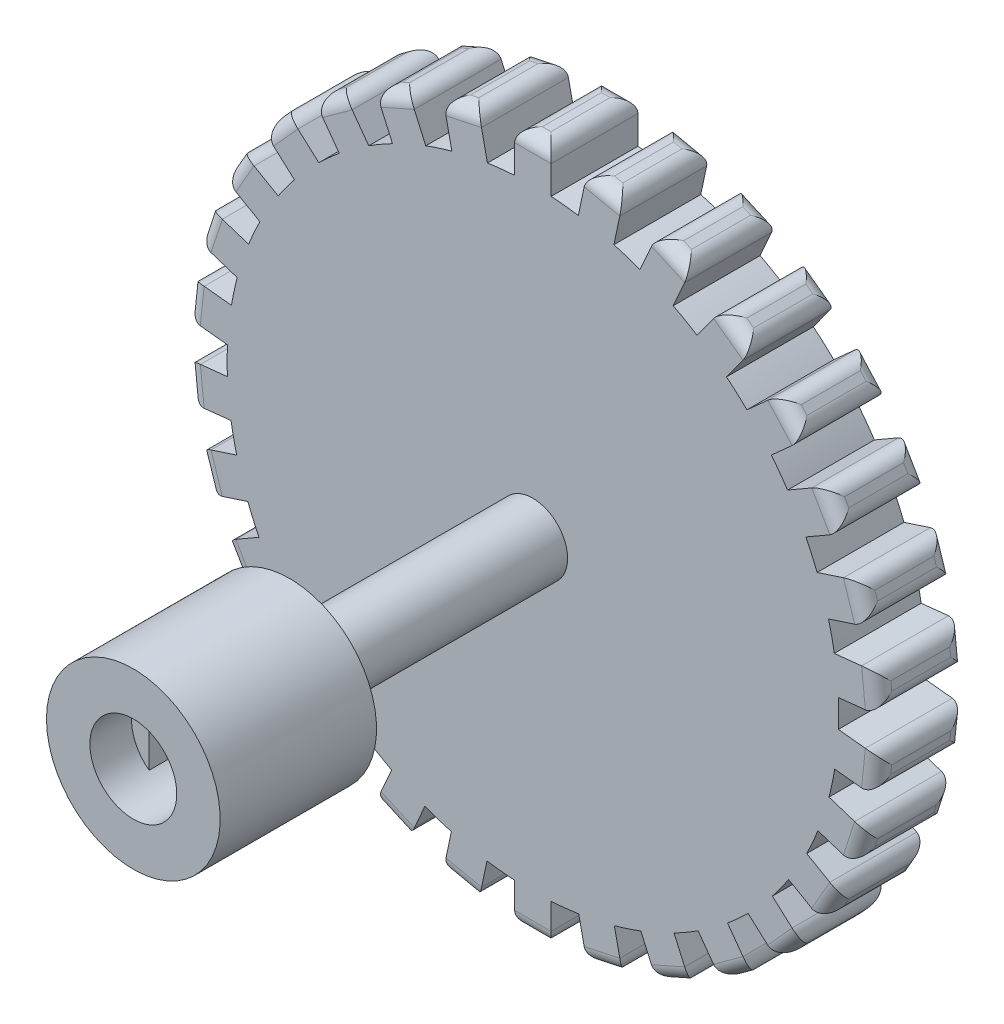
from build123d import *

# Parameters (mm, degrees)
SKETCH1_R                = 88
BOSS_EXTRUDE3_DEPTH      = 25
SKETCH4_W                = 10.4719
SKETCH4_H                = 13.351164338
BOSS_EXTRUDE4_DEPTH      = 25
FILLET2_R                = 4
CIRPATTERN1_COUNT        = 30
FILLET2_OF_CIRPATTERN1_R = 4
SKETCH6_R                = 10
BOSS_EXTRUDE5_DEPTH      = 60
BOSS_EXTRUDE6_START      = 10
SKETCH7_R                = 10
BOSS_EXTRUDE6_DEPTH      = 10
SKETCH8_R                = 10
BOSS_EXTRUDE7_DEPTH      = 10
SKETCH9_R                = 10
BOSS_EXTRUDE8_DEPTH      = 25
SKETCH10_R               = 10
BOSS_EXTRUDE9_DEPTH      = 42.5
SKETCH12_R               = 12.5
CUT_EXTRUDE1_DEPTH       = 12
CUT_EXTRUDE2_START       = -55.5
SKETCH13_R               = 10
CUT_EXTRUDE2_DEPTH       = 55.5
SKETCH14_R               = 25
BOSS_EXTRUDE10_DEPTH     = 45
SKETCH15_R               = 12.5
CUT_EXTRUDE3_DEPTH       = 12
CUT_EXTRUDE4_DEPTH       = 30.5


with BuildPart() as part:
    # Sketch1 → Boss-Extrude3 (new body)
    with BuildSketch(Plane.XY):
        Circle(SKETCH1_R)
    extrude(amount=BOSS_EXTRUDE3_DEPTH)

    # Sketch4 → Boss-Extrude4 (add)
    with BuildSketch(Plane.XY.offset(25)):
        with Locations((0, 93.324417831)):
            Rectangle(SKETCH4_W, SKETCH4_H)
    boss_extrude4 = extrude(amount=-BOSS_EXTRUDE4_DEPTH)

    # Fillet2
    fillet2_edges = [part.edges().sort_by_distance(p)[0] for p in [
        (5.23595, 100, 12.5),
        (0, 100, 0),
        (-5.23595, 100, 12.5),
        (0, 100, 25),
    ]]
    fillet(fillet2_edges, radius=FILLET2_R)

    # CirPattern1: Boss-Extrude4 ×30 about axis
    cirpattern1_axis = Axis((0, 0.317667884, 0), (0, 0, 1))
    for i in range(1, CIRPATTERN1_COUNT):
        add(boss_extrude4.rotate(cirpattern1_axis, i * 360 / CIRPATTERN1_COUNT))

    # Fillet2 of CirPattern1
    fillet2_of_cirpattern1_edges = [part.edges().sort_by_distance(p)[0] for p in [
        (-15.603590285, 98.910317096, 12.5),
        (-20.725122215, 97.821701879, 0),
        (-25.846654145, 96.733086661, 12.5),
        (-20.725122215, 97.821701879, 25),
        (-35.7611788, 93.511662322, 12.5),
        (-40.544457139, 91.382009596, 0),
        (-45.327735478, 89.252356869, 12.5),
        (-40.544457139, 91.382009596, 25),
        (-54.3558322, 84.039982796, 12.5),
        (-58.591804732, 80.962368605, 0),
        (-62.827777264, 77.884754413, 12.5),
        (-58.591804732, 80.962368605, 25),
        (-70.574874905, 70.909236365, 12.5),
        (-74.078409304, 67.018167216, 0),
        (-77.581943702, 63.127098067, 12.5),
        (-74.078409304, 67.018167216, 25),
        (-83.709456921, 54.693299655, 12.5),
        (-86.327431921, 50.158833942, 0),
        (-88.945406921, 45.624368229, 12.5),
        (-86.327431921, 50.158833942, 25),
        (-93.185533987, 36.100886913, 12.5),
        (-94.803531519, 31.121202547, 0),
        (-96.42152905, 26.14151818, 12.5),
        (-94.803531519, 31.121202547, 25),
        (-98.588956064, 15.944575793, 12.5),
        (-99.136261871, 10.737308875, 0),
        (-99.683567678, 5.530041957, 12.5),
        (-99.136261871, 10.737308875, 25),
        (-99.683567678, -4.894706189, 12.5),
        (-99.136261871, -10.101973107, 0),
        (-98.588956064, -15.309240025, 12.5),
        (-99.136261871, -10.101973107, 25),
        (-96.42152905, -25.506182413, 12.5),
        (-94.803531519, -30.485866779, 0),
        (-93.185533987, -35.465551145, 12.5),
        (-94.803531519, -30.485866779, 25),
        (-88.945406921, -44.989032461, 12.5),
        (-86.327431921, -49.523498174, 0),
        (-83.709456921, -54.057963887, 12.5),
        (-86.327431921, -49.523498174, 25),
        (-77.581943702, -62.491762299, 12.5),
        (-74.078409304, -66.382831448, 0),
        (-70.574874905, -70.273900597, 12.5),
        (-74.078409304, -66.382831448, 25),
        (-62.827777264, -77.249418645, 12.5),
        (-58.591804732, -80.327032837, 0),
        (-54.3558322, -83.404647029, 12.5),
        (-58.591804732, -80.327032837, 25),
        (-45.327735478, -88.617021102, 12.5),
        (-40.544457139, -90.746673828, 0),
        (-35.7611788, -92.876326554, 12.5),
        (-40.544457139, -90.746673828, 25),
        (-25.846654145, -96.097750894, 12.5),
        (-20.725122215, -97.186366111, 0),
        (-15.603590285, -98.274981329, 12.5),
        (-20.725122215, -97.186366111, 25),
        (-5.23595, -99.364664232, 12.5),
        (0, -99.364664232, 0),
        (5.23595, -99.364664232, 12.5),
        (0, -99.364664232, 25),
        (15.603590285, -98.274981329, 12.5),
        (20.725122215, -97.186366111, 0),
        (25.846654145, -96.097750894, 12.5),
        (20.725122215, -97.186366111, 25),
        (35.7611788, -92.876326554, 12.5),
        (40.544457139, -90.746673828, 0),
        (45.327735478, -88.617021102, 12.5),
        (40.544457139, -90.746673828, 25),
        (54.3558322, -83.404647029, 12.5),
        (58.591804732, -80.327032837, 0),
        (62.827777264, -77.249418645, 12.5),
        (58.591804732, -80.327032837, 25),
        (70.574874905, -70.273900597, 12.5),
        (74.078409304, -66.382831448, 0),
        (77.581943702, -62.491762299, 12.5),
        (74.078409304, -66.382831448, 25),
        (83.709456921, -54.057963887, 12.5),
        (86.327431921, -49.523498174, 0),
        (88.945406921, -44.989032461, 12.5),
        (86.327431921, -49.523498174, 25),
        (93.185533987, -35.465551145, 12.5),
        (94.803531519, -30.485866779, 0),
        (96.42152905, -25.506182413, 12.5),
        (94.803531519, -30.485866779, 25),
        (98.588956064, -15.309240025, 12.5),
        (99.136261871, -10.101973107, 0),
        (99.683567678, -4.894706189, 12.5),
        (99.136261871, -10.101973107, 25),
        (99.683567678, 5.530041957, 12.5),
        (99.136261871, 10.737308875, 0),
        (98.588956064, 15.944575793, 12.5),
        (99.136261871, 10.737308875, 25),
        (96.42152905, 26.14151818, 12.5),
        (94.803531519, 31.121202547, 0),
        (93.185533987, 36.100886913, 12.5),
        (94.803531519, 31.121202547, 25),
        (88.945406921, 45.624368229, 12.5),
        (86.327431921, 50.158833942, 0),
        (83.709456921, 54.693299655, 12.5),
        (86.327431921, 50.158833942, 25),
        (77.581943702, 63.127098067, 12.5),
        (74.078409304, 67.018167216, 0),
        (70.574874905, 70.909236365, 12.5),
        (74.078409304, 67.018167216, 25),
        (62.827777264, 77.884754413, 12.5),
        (58.591804732, 80.962368605, 0),
        (54.3558322, 84.039982796, 12.5),
        (58.591804732, 80.962368605, 25),
        (45.327735478, 89.252356869, 12.5),
        (40.544457139, 91.382009596, 0),
        (35.7611788, 93.511662322, 12.5),
        (40.544457139, 91.382009596, 25),
        (25.846654145, 96.733086661, 12.5),
        (20.725122215, 97.821701879, 0),
        (15.603590285, 98.910317096, 12.5),
        (20.725122215, 97.821701879, 25),
    ]]
    fillet(fillet2_of_cirpattern1_edges, radius=FILLET2_OF_CIRPATTERN1_R)

    # Sketch6 → Boss-Extrude5 (add)
    with BuildSketch(Plane.XY.offset(25)):
        Circle(SKETCH6_R)
    extrude(amount=BOSS_EXTRUDE5_DEPTH)

    # Sketch7 → Boss-Extrude6 (add)
    with BuildSketch(Plane(origin=(0, 0, 0), x_dir=(-1, 0, 0), z_dir=(0, 0, -1)).offset(BOSS_EXTRUDE6_START)):
        with Locations(Location((0, 0, 0), (0, 0, 180))):
            Circle(SKETCH7_R)
    extrude(amount=-BOSS_EXTRUDE6_DEPTH)

    # Sketch8 → Boss-Extrude7 (add)
    with BuildSketch(Plane.XY.offset(85)):
        Circle(SKETCH8_R)
    extrude(amount=BOSS_EXTRUDE7_DEPTH)

    # Sketch9 → Boss-Extrude8 (add)
    with BuildSketch(Plane.XY.offset(95)):
        Circle(SKETCH9_R)
    extrude(amount=BOSS_EXTRUDE8_DEPTH)

    # Sketch10 → Boss-Extrude9 (add)
    with BuildSketch(Plane.XY.offset(120)):
        Circle(SKETCH10_R)
    extrude(amount=BOSS_EXTRUDE9_DEPTH)

    # Sketch12 → Cut-Extrude1 (cut)
    with BuildSketch(Plane.XY.offset(162.5)):
        Circle(SKETCH12_R)
    extrude(amount=-CUT_EXTRUDE1_DEPTH, mode=Mode.SUBTRACT)

    # Sketch13 → Cut-Extrude2 (cut)
    with BuildSketch(Plane.XY.offset(150.5).offset(CUT_EXTRUDE2_START)):
        Circle(SKETCH13_R)
    extrude(amount=CUT_EXTRUDE2_DEPTH, mode=Mode.SUBTRACT)

    # Sketch14 → Boss-Extrude10 (add)
    with BuildSketch(Plane.XY.offset(95)):
        with Locations(Location((0, 0, 0), (0, 0, 180))):
            Circle(SKETCH14_R)
    extrude(amount=BOSS_EXTRUDE10_DEPTH)

    # Sketch15 → Cut-Extrude3 (cut)
    with BuildSketch(Plane.XY.offset(140)):
        Circle(SKETCH15_R)
    extrude(amount=-CUT_EXTRUDE3_DEPTH, mode=Mode.SUBTRACT)

    # Sketch16 → Cut-Extrude4 (cut)
    with BuildSketch(Plane.XY.offset(128)):
        with BuildLine():
            Line((7.45, -10.037305415), (7.45, 10.037305415))
            ThreePointArc((7.45, 10.037305415), (0, 12.5), (-7.45, 10.037305415))
            Line((-7.45, 10.037305415), (-7.45, -10.037305415))
            ThreePointArc((-7.45, -10.037305415), (0, -12.5), (7.45, -10.037305415))
        make_face()
    extrude(amount=-CUT_EXTRUDE4_DEPTH, mode=Mode.SUBTRACT)


solid = part.part
